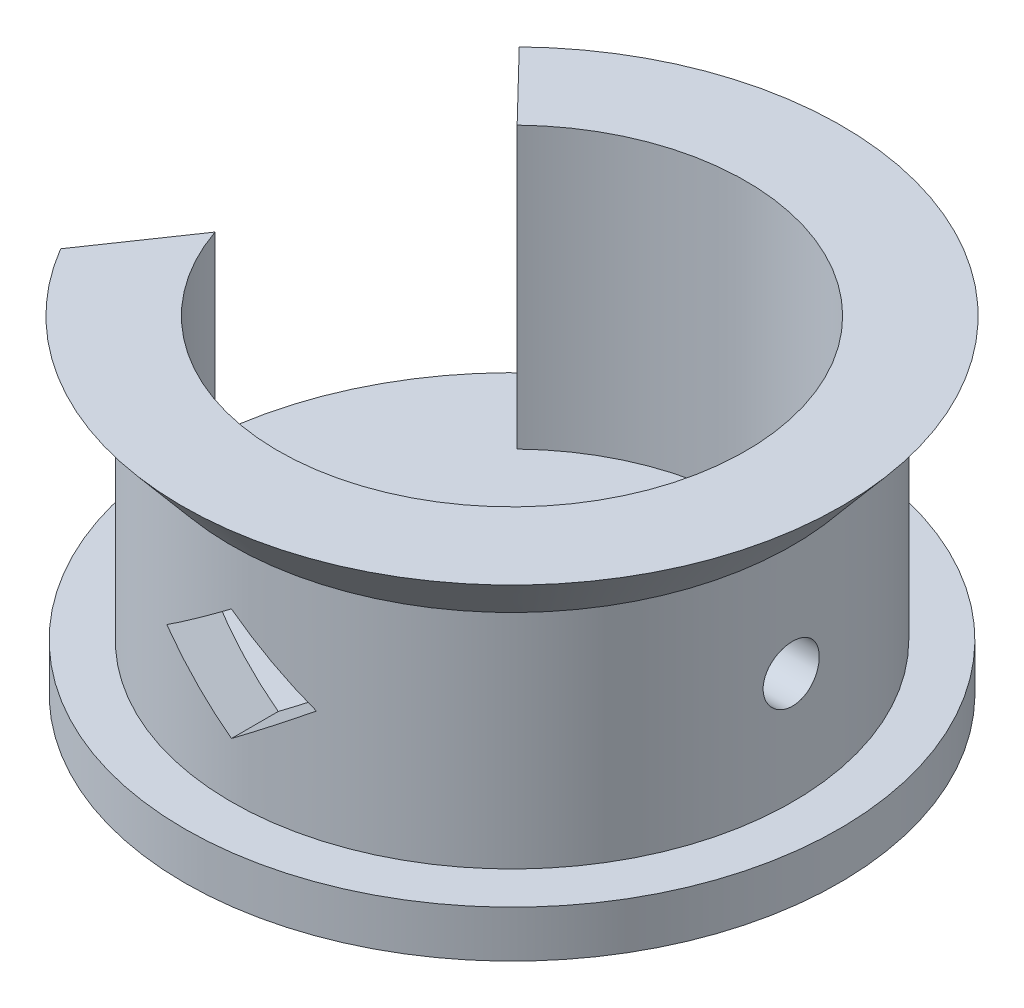
from build123d import *

# Parameters (mm, degrees)
SKETCH4_R           = 7
BOSS_EXTRUDE3_DEPTH = 1
SKETCH5_R           = 6
SKETCH5_R_2         = 5
BOSS_EXTRUDE4_DEPTH = 4.75
SKETCH6_W           = 6
SKETCH6_H           = 1.25
CUT_EXTRUDE3_START  = -3
SKETCH9_R           = 5
CUT_EXTRUDE3_DEPTH  = 3
CUT_EXTRUDE7_DEPTH  = 10
SKETCH13_R          = 2.4
CUT_EXTRUDE8_DEPTH  = 10
CUT_EXTRUDE9_START  = -6
CUT_EXTRUDE9_DEPTH  = 6
SKETCH15_R          = 0.6
CUT_EXTRUDE10_DEPTH = 10


with BuildPart() as part:
    # Sketch4 → Boss-Extrude3 (new body)
    with BuildSketch(Plane(origin=(0, 0, 0), x_dir=(1, 0, 0), z_dir=(0, 1, 0))):
        Circle(SKETCH4_R)
    extrude(amount=BOSS_EXTRUDE3_DEPTH)

    # Sketch5 → Boss-Extrude4 (add)
    with BuildSketch(Plane(origin=(0, 1, 0), x_dir=(1, 0, 0), z_dir=(0, 1, 0))):
        Circle(SKETCH5_R)
        Circle(SKETCH5_R_2, mode=Mode.SUBTRACT)
    extrude(amount=BOSS_EXTRUDE4_DEPTH)

    # Sketch6 → Revolve4 (revolve)
    with BuildSketch(Plane.XY):
        with Locations((3, 6.375)):
            Rectangle(SKETCH6_W, SKETCH6_H)
    revolve(axis=Axis((0, 5.75, 0), (0, 1, 0)))

    # Sketch9 → Cut-Extrude3 (cut)
    with BuildSketch(Plane(origin=(0, 7, 0), x_dir=(1, 0, 0), z_dir=(0, 1, 0)).offset(CUT_EXTRUDE3_START)):
        Circle(SKETCH9_R)
    extrude(amount=CUT_EXTRUDE3_DEPTH, mode=Mode.SUBTRACT)

    # Sketch11 → Cut-Extrude7 (cut)
    with BuildSketch(Plane.XY):
        Polygon((0, 4.575), (-1.6, 3.375), (0, 2.175), (1.6, 3.375), align=None)
    extrude(amount=CUT_EXTRUDE7_DEPTH, mode=Mode.SUBTRACT)

    # Sketch12 → Revolve8 (revolve)
    with BuildSketch(Plane(origin=(0, 0, 0), x_dir=(0, 0, -1), z_dir=(1, 0, 0))):
        Polygon((-6, 5.75), (-6, 7), (-7.048874539, 7), align=None)
    revolve(axis=Axis((0, 7, 0), (0, 1, 0)))

    # Sketch13 → Cut-Extrude8 (cut)
    with BuildSketch(Plane(origin=(0, 1, 0), x_dir=(1, 0, 0), z_dir=(0, 1, 0))):
        Circle(SKETCH13_R)
    extrude(amount=-CUT_EXTRUDE8_DEPTH, mode=Mode.SUBTRACT)

    # Sketch14 → Cut-Extrude9 (cut)
    with BuildSketch(Plane(origin=(0, 7, 0), x_dir=(1, 0, 0), z_dir=(0, 1, 0)).offset(CUT_EXTRUDE9_START)):
        with BuildLine():
            Line((-6.070978941, -3.581877575), (-4.730045335, -1.620700813))
            ThreePointArc((-4.730045335, -1.620700813), (-4.862114505, 1.166122867), (-3.480349058, 3.589870532))
            Line((-3.480349058, 3.589870532), (-4.906508772, 5.060909398))
            ThreePointArc((-4.906508772, 5.060909398), (-6.985753416, 0.941212769), (-6.070978941, -3.581877575))
        make_face()
    extrude(amount=CUT_EXTRUDE9_DEPTH, mode=Mode.SUBTRACT)

    # Sketch15 → Cut-Extrude10 (cut)
    with BuildSketch(Plane(origin=(0, 0, 0), x_dir=(0, 0, -1), z_dir=(1, 0, 0))):
        with Locations((0, 3.375)):
            Circle(SKETCH15_R)
    extrude(amount=CUT_EXTRUDE10_DEPTH, mode=Mode.SUBTRACT)


solid = part.part
